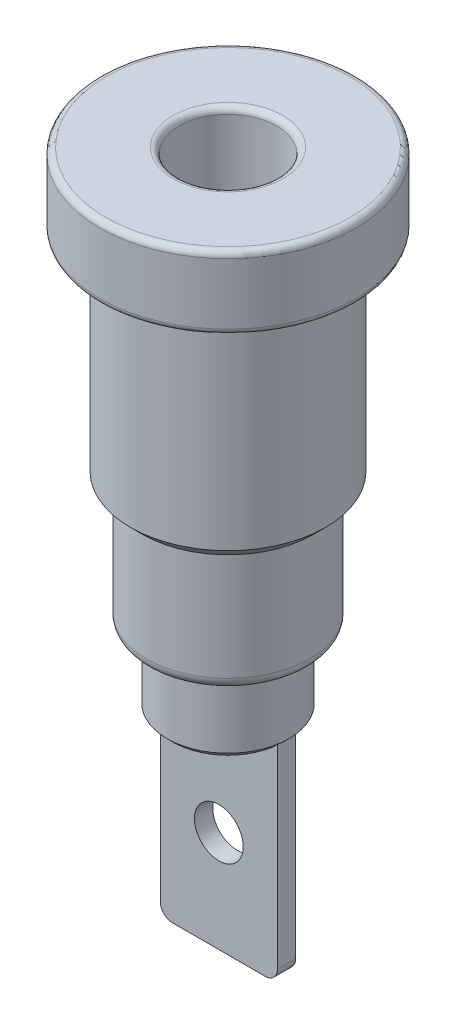
from build123d import *

# Parameters (mm, degrees)
SKETCH2_R           = 1
BOSS_EXTRUDE1_DEPTH = 0.375
CHAMFER1_SIZE       = 0.25
CHAMFER2_SIZE       = 0.5
FILLET1_R           = 0.25


with BuildPart() as part:
    # Sketch1 → Revolve1 (revolve)
    with BuildSketch(Plane.XY):
        with BuildLine():
            Line((-2, 0), (-5.25, 0))
            Line((-5.25, 0), (-5.25, -3))
            Line((-5.25, -3), (-4, -3))
            Line((-4, -3), (-4, -12))
            Line((-4, -12), (-3.34, -12))
            Line((-3.34, -12), (-3.34, -16.5))
            ThreePointArc((-3.34, -16.5), (-3.193553391, -16.853553391), (-2.84, -17))
            Line((-2.84, -17), (-2.5, -17))
            Line((-2.5, -17), (-2.5, -20))
            Line((-2.5, -20), (0, -20))
            Line((0, -20), (0, -8))
            Line((0, -8), (-2, -8))
            Line((-2, -8), (-2, 0))
        make_face()
    revolve(axis=Axis((0, -20, 0), (0, -1, 0)))

    # Sketch2 → Boss-Extrude1 (add, symmetric)
    with BuildSketch(Plane.XY):
        with BuildLine():
            Line((-2.4, -20), (-2.4, -27.8))
            ThreePointArc((-2.4, -27.8), (-2.253553391, -28.153553391), (-1.9, -28.3))
            Line((-1.9, -28.3), (1.9, -28.3))
            ThreePointArc((1.9, -28.3), (2.253553391, -28.153553391), (2.4, -27.8))
            Line((2.4, -27.8), (2.4, -20))
            Line((2.4, -20), (-2.4, -20))
        make_face()
        with Locations((0, -24.15)):
            Circle(SKETCH2_R, mode=Mode.SUBTRACT)
    extrude(amount=BOSS_EXTRUDE1_DEPTH, both=True)

    # Chamfer1
    # the kernel refuses this chamfer: 0.25 mm, written as the material it takes off along each edge
    with BuildSketch(Plane(origin=(0, -20, 0), x_dir=(-1, 0, 0), z_dir=(0, 0, 1))) as chamfer1_piece_1_section:
        Polygon((2.5 - CHAMFER1_SIZE, 0), (2.5, -CHAMFER1_SIZE), (2.5, 0), align=None)
    chamfer1_piece_1 = revolve(axis=Axis((0, -20, 0), (0, -1, 0)), mode=Mode.PRIVATE)
    chamfer1_piece_1 = split(chamfer1_piece_1, bisect_by=Plane(origin=(-2.4, -19.896022541, 0), z_dir=(-1, 0, 0)), keep=Keep.TOP, mode=Mode.PRIVATE)
    add(chamfer1_piece_1, mode=Mode.SUBTRACT)
    with BuildSketch(Plane(origin=(0, -20, 0), x_dir=(-1, 0, 0), z_dir=(0, 0, 1))) as chamfer1_piece_2_section:
        Polygon((2.5 - CHAMFER1_SIZE, 0), (2.5, -CHAMFER1_SIZE), (2.5, 0), align=None)
    chamfer1_piece_2 = revolve(axis=Axis((0, -20, 0), (0, -1, 0)), mode=Mode.PRIVATE)
    chamfer1_piece_2 = split(chamfer1_piece_2, bisect_by=Plane(origin=(-7e-09, -19.879189064, -0.375), z_dir=(0, 0, -1)), keep=Keep.TOP, mode=Mode.PRIVATE)
    add(chamfer1_piece_2, mode=Mode.SUBTRACT)
    with BuildSketch(Plane(origin=(0, -20, 0), x_dir=(-1, 0, 0), z_dir=(0, 0, 1))) as chamfer1_piece_3_section:
        Polygon((2.5 - CHAMFER1_SIZE, 0), (2.5, -CHAMFER1_SIZE), (2.5, 0), align=None)
    chamfer1_piece_3 = revolve(axis=Axis((0, -20, 0), (0, -1, 0)), mode=Mode.PRIVATE)
    chamfer1_piece_3 = split(chamfer1_piece_3, bisect_by=Plane(origin=(-7e-09, -19.879189064, 0.375), z_dir=(0, 0, 1)), keep=Keep.TOP, mode=Mode.PRIVATE)
    add(chamfer1_piece_3, mode=Mode.SUBTRACT)
    with BuildSketch(Plane(origin=(0, -20, 0), x_dir=(-1, 0, 0), z_dir=(0, 0, 1))) as chamfer1_piece_4_section:
        Polygon((2.5 - CHAMFER1_SIZE, 0), (2.5, -CHAMFER1_SIZE), (2.5, 0), align=None)
    chamfer1_piece_4 = revolve(axis=Axis((0, -20, 0), (0, -1, 0)), mode=Mode.PRIVATE)
    chamfer1_piece_4 = split(chamfer1_piece_4, bisect_by=Plane(origin=(2.4, -19.896022542, 0), z_dir=(1, 0, 0)), keep=Keep.TOP, mode=Mode.PRIVATE)
    add(chamfer1_piece_4, mode=Mode.SUBTRACT)

    # Chamfer2
    chamfer2_edges = [part.edges().sort_by_distance(p)[0] for p in [
        (4, -12, 0),
    ]]
    chamfer(chamfer2_edges, length=CHAMFER2_SIZE)

    # Fillet1
    fillet1_edges = [part.edges().sort_by_distance(p)[0] for p in [
        (2, -8, 0),
        (5.25, -3, 0),
        (5.25, 0, 0),
        (2, 0, 0),
    ]]
    fillet(fillet1_edges, radius=FILLET1_R)


solid = part.part
